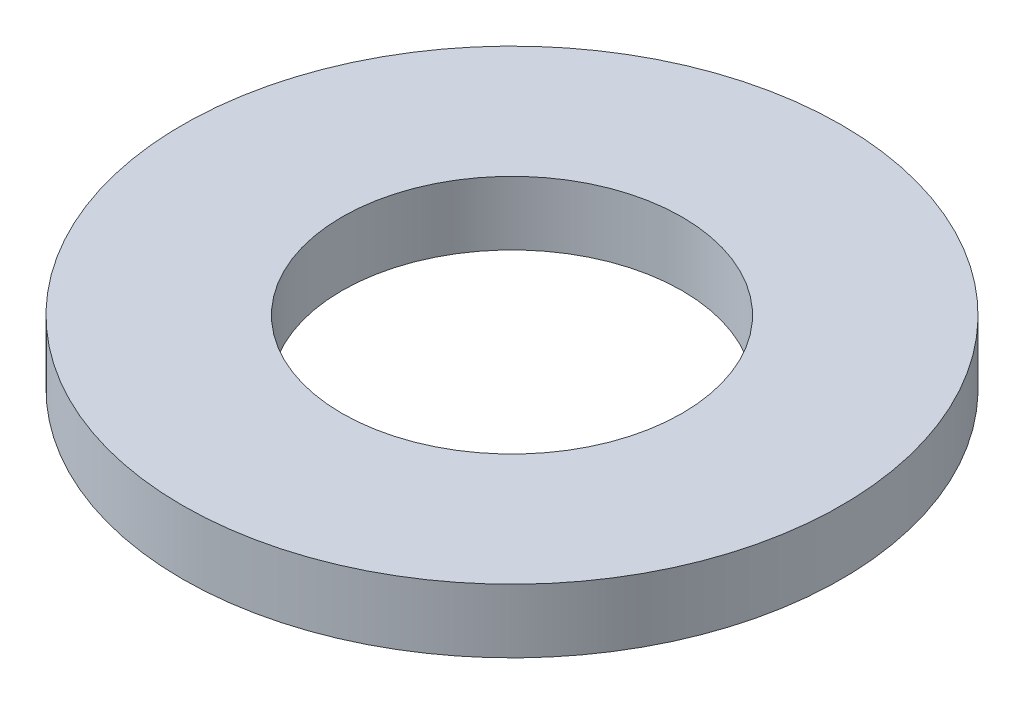
from build123d import *

# Parameters (mm, degrees)
SKETCH1_R           = 77.5
BOSS_EXTRUDE1_DEPTH = 15
SKETCH2_R           = 40
CUT_EXTRUDE1_DEPTH  = 111.623234449


with BuildPart() as part:
    # Sketch1 → Boss-Extrude1 (new body)
    with BuildSketch(Plane(origin=(0, 0, 0), x_dir=(1, 0, 0), z_dir=(0, 1, 0))):
        Circle(SKETCH1_R)
    extrude(amount=BOSS_EXTRUDE1_DEPTH)

    # Sketch2 → Cut-Extrude1 (cut, through all)
    with BuildSketch(Plane(origin=(0, 0, 0), x_dir=(1, 0, 0), z_dir=(0, 1, 0))):
        Circle(SKETCH2_R)
    extrude(amount=CUT_EXTRUDE1_DEPTH, mode=Mode.SUBTRACT)


solid = part.part
